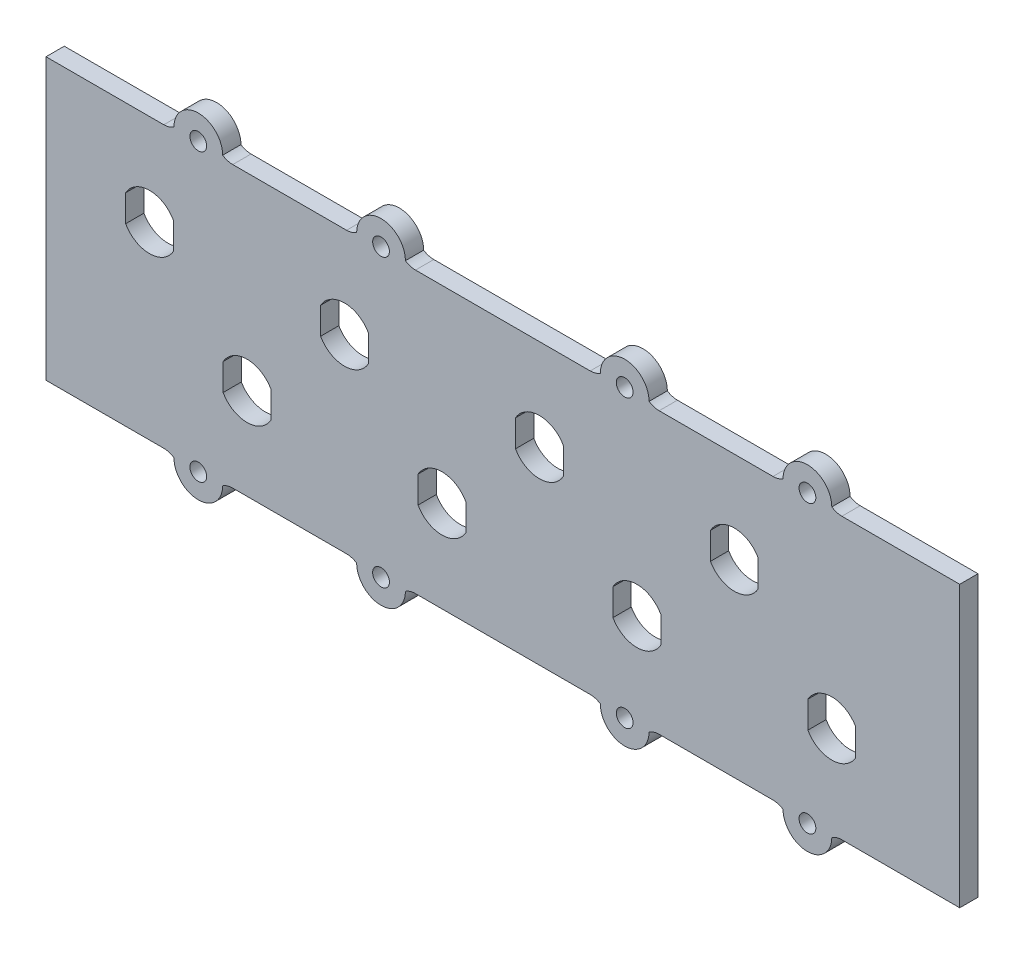
from build123d import *

# Parameters (mm, degrees)
SKETCH1_R           = 1.375
BOSS_EXTRUDE1_DEPTH = 3


with BuildPart() as part:
    # Sketch1 → Boss-Extrude1 (new body)
    with BuildSketch(Plane.XY):
        with BuildLine():
            Line((-55.658312395, 23), (-75, 23))
            Line((-75, 23), (-75, -23))
            Line((-75, -23), (-55.658312395, -23))
            ThreePointArc((-55.658312395, -23), (-54.792286991, -23.127718677), (-54, -23.5))
            ThreePointArc((-54, -23.5), (-50, -27.5), (-46, -23.5))
            ThreePointArc((-46, -23.5), (-45.207713009, -23.127718677), (-44.341687605, -23))
            Line((-44.341687605, -23), (-25.658312395, -23))
            ThreePointArc((-25.658312395, -23), (-24.792286991, -23.127718677), (-24, -23.5))
            ThreePointArc((-24, -23.5), (-20, -27.5), (-16, -23.5))
            ThreePointArc((-16, -23.5), (-15.207713009, -23.127718677), (-14.341687605, -23))
            Line((-14.341687605, -23), (14.341687605, -23))
            ThreePointArc((14.341687605, -23), (15.207713009, -23.127718677), (16, -23.5))
            ThreePointArc((16, -23.5), (20, -27.5), (24, -23.5))
            ThreePointArc((24, -23.5), (24.792286991, -23.127718677), (25.658312395, -23))
            Line((25.658312395, -23), (44.341687605, -23))
            ThreePointArc((44.341687605, -23), (45.207713009, -23.127718677), (46, -23.5))
            ThreePointArc((46, -23.5), (50, -27.5), (54, -23.5))
            ThreePointArc((54, -23.5), (54.792286991, -23.127718677), (55.658312395, -23))
            Line((55.658312395, -23), (75, -23))
            Line((75, -23), (75, 23))
            Line((75, 23), (55.658312395, 23))
            ThreePointArc((55.658312395, 23), (54.792286991, 23.127718677), (54, 23.5))
            ThreePointArc((54, 23.5), (50, 27.5), (46, 23.5))
            ThreePointArc((46, 23.5), (45.207713009, 23.127718677), (44.341687605, 23))
            Line((44.341687605, 23), (25.658312395, 23))
            ThreePointArc((25.658312395, 23), (24.792286991, 23.127718677), (24, 23.5))
            ThreePointArc((24, 23.5), (20, 27.5), (16, 23.5))
            ThreePointArc((16, 23.5), (15.207713009, 23.127718677), (14.341687605, 23))
            Line((14.341687605, 23), (-14.341687605, 23))
            ThreePointArc((-14.341687605, 23), (-15.207713009, 23.127718677), (-16, 23.5))
            ThreePointArc((-16, 23.5), (-20, 27.5), (-24, 23.5))
            ThreePointArc((-24, 23.5), (-24.792286991, 23.127718677), (-25.658312395, 23))
            Line((-25.658312395, 23), (-44.341687605, 23))
            ThreePointArc((-44.341687605, 23), (-45.207713009, 23.127718677), (-46, 23.5))
            ThreePointArc((-46, 23.5), (-50, 27.5), (-54, 23.5))
            ThreePointArc((-54, 23.5), (-54.792286991, 23.127718677), (-55.658312395, 23))
        make_face()
        with Locations((-50, -23.5)):
            Circle(SKETCH1_R, mode=Mode.SUBTRACT)
        with Locations((-20, -23.5)):
            Circle(SKETCH1_R, mode=Mode.SUBTRACT)
        with BuildLine():
            ThreePointArc((-38.075, -10.200994094), (-42, -12.5), (-45.925, -10.200994094))
            Line((-45.925, -10.200994094), (-45.925, -5.799005906))
            ThreePointArc((-45.925, -5.799005906), (-42, -3.5), (-38.075, -5.799005906))
            Line((-38.075, -5.799005906), (-38.075, -10.200994094))
        make_face(mode=Mode.SUBTRACT)
        with BuildLine():
            ThreePointArc((-6.075, -10.200994094), (-10, -12.5), (-13.925, -10.200994094))
            Line((-13.925, -10.200994094), (-13.925, -5.799005906))
            ThreePointArc((-13.925, -5.799005906), (-10, -3.5), (-6.075, -5.799005906))
            Line((-6.075, -5.799005906), (-6.075, -10.200994094))
        make_face(mode=Mode.SUBTRACT)
        with Locations((20, -23.5)):
            Circle(SKETCH1_R, mode=Mode.SUBTRACT)
        with Locations((50, -23.5)):
            Circle(SKETCH1_R, mode=Mode.SUBTRACT)
        with BuildLine():
            ThreePointArc((25.925, -10.200994094), (22, -12.5), (18.075, -10.200994094))
            Line((18.075, -10.200994094), (18.075, -5.799005906))
            ThreePointArc((18.075, -5.799005906), (22, -3.5), (25.925, -5.799005906))
            Line((25.925, -5.799005906), (25.925, -10.200994094))
        make_face(mode=Mode.SUBTRACT)
        with BuildLine():
            ThreePointArc((57.925, -10.200994094), (54, -12.5), (50.075, -10.200994094))
            Line((50.075, -10.200994094), (50.075, -5.799005906))
            ThreePointArc((50.075, -5.799005906), (54, -3.5), (57.925, -5.799005906))
            Line((57.925, -5.799005906), (57.925, -10.200994094))
        make_face(mode=Mode.SUBTRACT)
        with BuildLine():
            ThreePointArc((-61.925, 10.200994094), (-58, 12.5), (-54.075, 10.200994094))
            Line((-54.075, 10.200994094), (-54.075, 5.799005906))
            ThreePointArc((-54.075, 5.799005906), (-58, 3.5), (-61.925, 5.799005906))
            Line((-61.925, 5.799005906), (-61.925, 10.200994094))
        make_face(mode=Mode.SUBTRACT)
        with BuildLine():
            ThreePointArc((-22.075, 5.799005906), (-26, 3.5), (-29.925, 5.799005906))
            Line((-29.925, 5.799005906), (-29.925, 10.200994094))
            ThreePointArc((-29.925, 10.200994094), (-26, 12.5), (-22.075, 10.200994094))
            Line((-22.075, 10.200994094), (-22.075, 5.799005906))
        make_face(mode=Mode.SUBTRACT)
        with Locations((-50, 23.5)):
            Circle(SKETCH1_R, mode=Mode.SUBTRACT)
        with Locations((-20, 23.5)):
            Circle(SKETCH1_R, mode=Mode.SUBTRACT)
        with BuildLine():
            ThreePointArc((9.925, 5.799005906), (6, 3.5), (2.075, 5.799005906))
            Line((2.075, 5.799005906), (2.075, 10.200994094))
            ThreePointArc((2.075, 10.200994094), (6, 12.5), (9.925, 10.200994094))
            Line((9.925, 10.200994094), (9.925, 5.799005906))
        make_face(mode=Mode.SUBTRACT)
        with BuildLine():
            ThreePointArc((41.925, 5.799005906), (38, 3.5), (34.075, 5.799005906))
            Line((34.075, 5.799005906), (34.075, 10.200994094))
            ThreePointArc((34.075, 10.200994094), (38, 12.5), (41.925, 10.200994094))
            Line((41.925, 10.200994094), (41.925, 5.799005906))
        make_face(mode=Mode.SUBTRACT)
        with Locations((20, 23.5)):
            Circle(SKETCH1_R, mode=Mode.SUBTRACT)
        with Locations((50, 23.5)):
            Circle(SKETCH1_R, mode=Mode.SUBTRACT)
    extrude(amount=BOSS_EXTRUDE1_DEPTH)


solid = part.part
